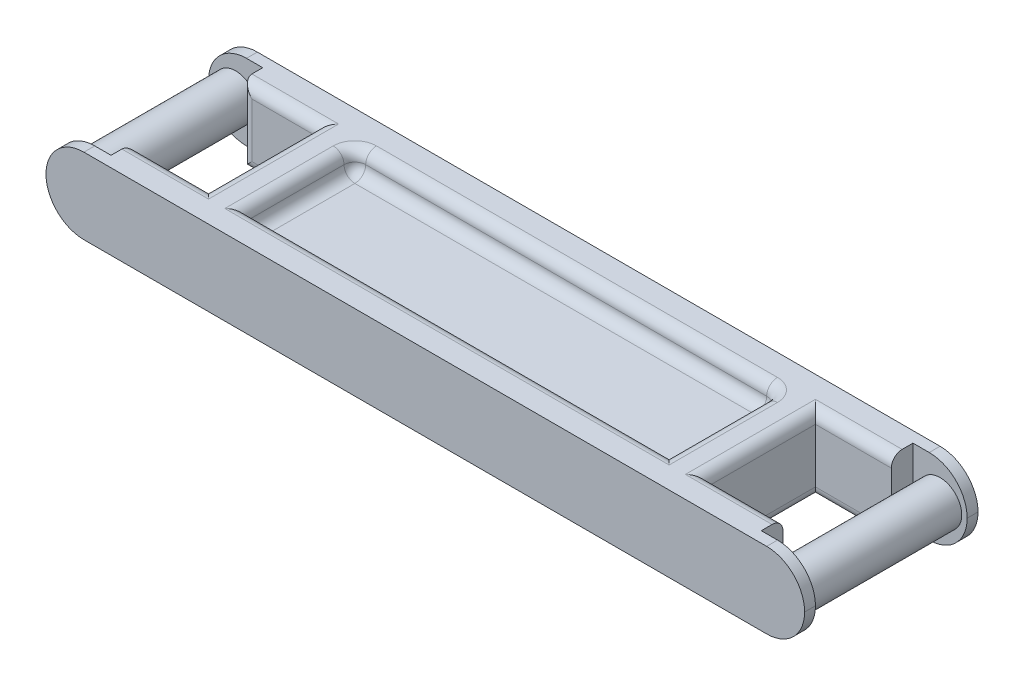
from build123d import *

# Parameters (mm, degrees)
SKETCH1_W           = 70
SKETCH1_H           = 16
BOSS_EXTRUDE1_DEPTH = 7
CUT_EXTRUDE1_DEPTH  = 17
SKETCH3_R           = 2
BOSS_EXTRUDE2_DEPTH = 14
SKETCH4_W           = 39
SKETCH4_H           = 10
CUT_EXTRUDE2_DEPTH  = 2
FILLET1_R           = 1
FILLET2_R           = 3.5


with BuildPart() as part:
    # Sketch1 → Boss-Extrude1 (new body)
    with BuildSketch(Plane(origin=(0, 0, 0), x_dir=(1, 0, 0), z_dir=(0, 1, 0))):
        Rectangle(SKETCH1_W, SKETCH1_H)
    extrude(amount=BOSS_EXTRUDE1_DEPTH)

    # Sketch2 → Cut-Extrude1 (cut)
    with BuildSketch(Plane(origin=(0, 7, 0), x_dir=(1, 0, 0), z_dir=(0, 1, 0))):
        Polygon((-30, 7), (-35, 7), (-35, -7), (-30, -7), (-30, -5), (-23, -5), (-23, 5), (-30, 5), align=None)
        Polygon((30, -5), (30, -7), (35, -7), (35, 7), (30, 7), (30, 5), (23, 5), (23, -5), align=None)
    extrude(amount=-CUT_EXTRUDE1_DEPTH, mode=Mode.SUBTRACT)

    # Sketch3 → Boss-Extrude2 (add)
    with BuildSketch(Plane.XY.offset(-7)):
        with Locations((-32.5, 3.5)):
            Circle(SKETCH3_R)
        with Locations(Location((32.5, 3.5, 0), (0, 0, 180))):
            Circle(SKETCH3_R)
    extrude(amount=BOSS_EXTRUDE2_DEPTH)

    # Sketch4 → Cut-Extrude2 (cut)
    with BuildSketch(Plane(origin=(0, 7, 0), x_dir=(1, 0, 0), z_dir=(0, 1, 0))):
        Rectangle(SKETCH4_W, SKETCH4_H)
    cut_extrude2 = extrude(amount=-CUT_EXTRUDE2_DEPTH, mode=Mode.SUBTRACT)

    # Mirror1: Cut-Extrude2 across plane
    add(cut_extrude2.mirror(Plane.ZX.offset(3.5)), mode=Mode.SUBTRACT)

    # Fillet1
    fillet1_edges = [part.edges().sort_by_distance(p)[0] for p in [
        (19.5, 0, 0),
        (0, 0, -5),
        (-19.5, 0, 0),
        (0, 0, 5),
        (19.5, 2, 0),
        (0, 2, -5),
        (-19.5, 2, 0),
        (0, 2, 5),
        (26.5, 0, -5),
        (23, 0, 0),
        (26.5, 0, 5),
        (-26.5, 0, -5),
        (-23, 0, 0),
        (-26.5, 0, 5),
        (-23, 7, 0),
        (-30, 3.5, 5),
        (-30, 3.5, -5),
        (-26.5, 7, -5),
        (-26.5, 7, 5),
        (26.5, 7, 5),
        (26.5, 7, -5),
        (23, 7, 0),
        (19.5, 5, 0),
        (19.5, 6, -5),
        (0, 5, 5),
        (-19.5, 5, 0),
        (0, 5, -5),
        (-19.5, 6, -5),
        (19.5, 7, 0),
        (0, 7, -5),
        (-19.5, 7, 0),
        (0, 7, 5),
    ]]
    fillet(fillet1_edges, radius=FILLET1_R - 0.0001)  # a hair under: the kernel refuses the full size

    # Fillet2
    fillet2_edges = [part.edges().sort_by_distance(p)[0] for p in [
        (-35, 7, 7.5),
        (-35, 0, 7.5),
        (-35, 0, -7.5),
        (-35, 7, -7.5),
        (35, 0, -7.5),
        (35, 7, -7.5),
        (35, 0, 7.5),
        (35, 7, 7.5),
    ]]
    fillet(fillet2_edges, radius=FILLET2_R - 0.0001)  # a hair under: the kernel refuses the full size


solid = part.part
